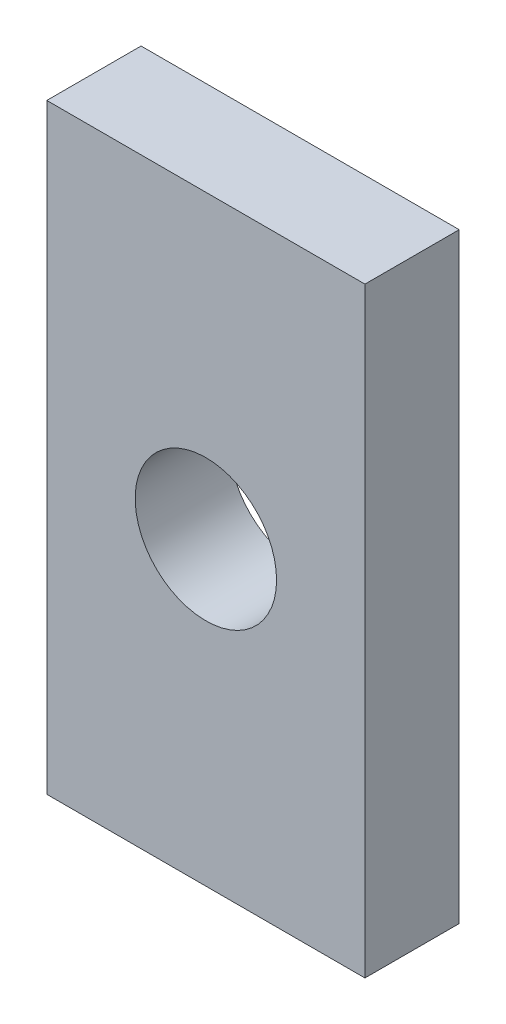
from build123d import *

# Parameters (mm, degrees)
SKETCH1_W           = 40.5
SKETCH1_H           = 76.5
BOSS_EXTRUDE1_DEPTH = 12
CUT_EXTRUDE1_REACH  = 46.912
SKETCH2_R           = 9


with BuildPart() as part:
    # Sketch1 → Boss-Extrude1 (new body)
    with BuildSketch(Plane.XY):
        Rectangle(SKETCH1_W, SKETCH1_H)
    extrude(amount=BOSS_EXTRUDE1_DEPTH)

    # Sketch2 → Cut-Extrude1 (cut, up to next)
    with BuildSketch(Plane.XY.offset(12), mode=Mode.PRIVATE) as cut_extrude1_sk1:
        Circle(SKETCH2_R)
    cut_extrude1_tool1 = extrude(cut_extrude1_sk1.sketch, amount=-CUT_EXTRUDE1_REACH, mode=Mode.PRIVATE) & part.part
    add(cut_extrude1_tool1.solids().sort_by_distance((0, 0, 12))[0], mode=Mode.SUBTRACT)


solid = part.part
